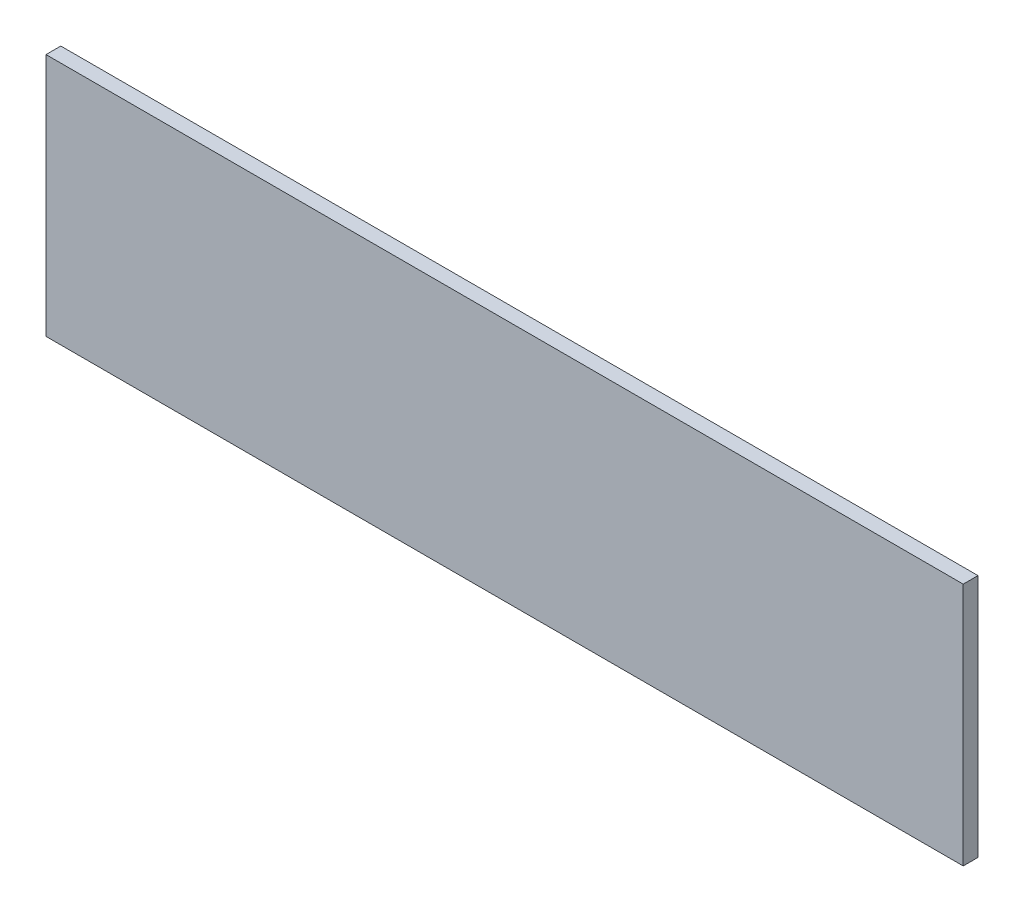
from build123d import *

# Parameters (mm, degrees)
SKETCH1_W           = 124
SKETCH1_H           = 33
BOSS_EXTRUDE1_DEPTH = 2


with BuildPart() as part:
    # Sketch1 → Boss-Extrude1 (new body)
    with BuildSketch(Plane.XY):
        Rectangle(SKETCH1_W, SKETCH1_H)
    extrude(amount=BOSS_EXTRUDE1_DEPTH)


solid = part.part
